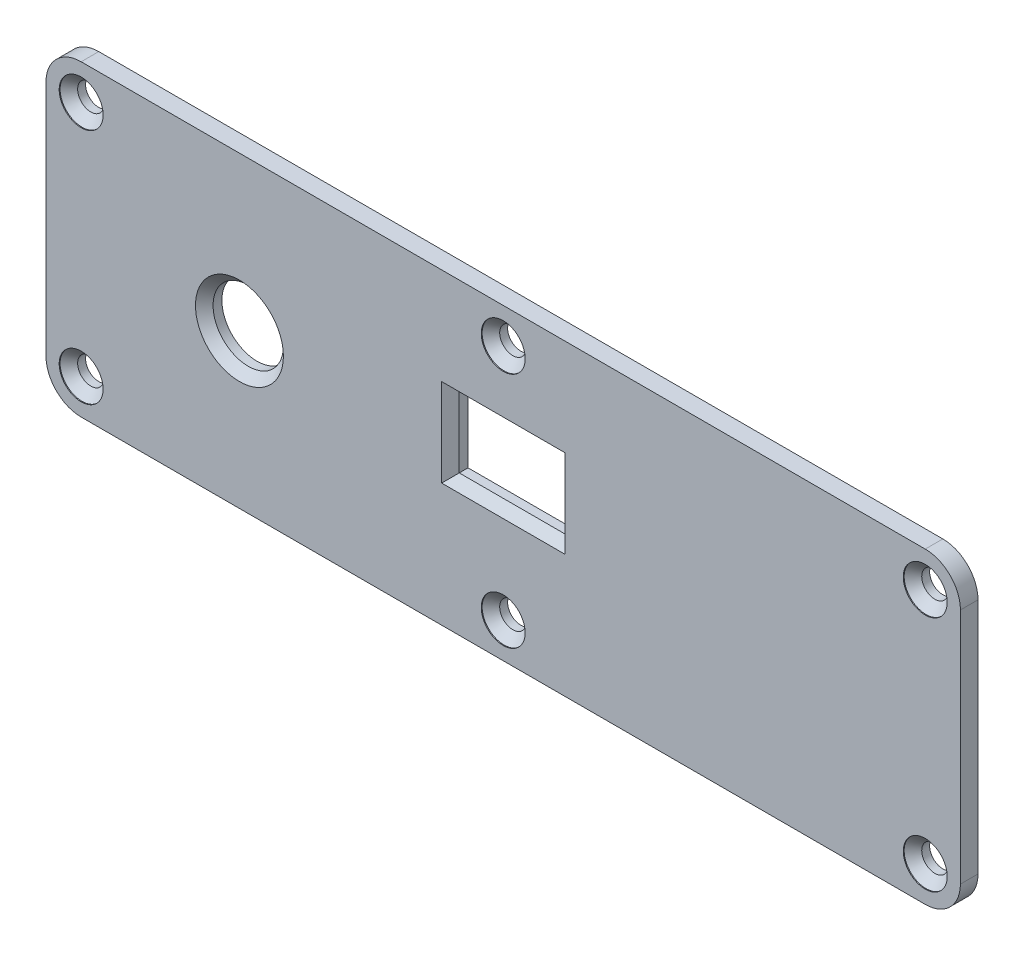
from build123d import *

# Parameters (mm, degrees)
IZIM1_W                     = 104
IZIM1_H                     = 35
Y_KSEKLIK_EKSTR_ZYON1_DEPTH = 2
IZIM2_R                     = 1.5
KES_EKSTR_ZYON1_DEPTH       = 2
IZIM3_R                     = 2.5
KES_EKSTR_ZYON2_DEPTH       = 0.1
PAH2_SIZE                   = 1
IZIM4_R                     = 1.5
KES_EKSTR_ZYON3_DEPTH       = 2
IZIM5_R                     = 2.5
KES_EKSTR_ZYON4_DEPTH       = 0.1
PAH3_SIZE                   = 1
RADYUS1_R                   = 4
IZIM6_R                     = 4
IZIM6_W                     = 12
IZIM6_H                     = 8
KES_EKSTR_ZYON5_DEPTH       = 2
PAH4_SIZE                   = 1
PAH5_SIZE                   = 1


with BuildPart() as part:
    # Çizim1 → Yükseklik-Ekstrüzyon1 (new body)
    with BuildSketch(Plane.XY):
        with Locations((-52, 17.5)):
            Rectangle(IZIM1_W, IZIM1_H)
    extrude(amount=Y_KSEKLIK_EKSTR_ZYON1_DEPTH)

    # Çizim2 → Kes-Ekstrüzyon1 (cut)
    with BuildSketch(Plane.XY.offset(2)):
        with Locations((-100, 31)):
            Circle(IZIM2_R)
        with Locations((-100, 4)):
            Circle(IZIM2_R)
        with Locations(Location((-4, 4, 0), (0, 0, 180))):
            Circle(IZIM2_R)
        with Locations(Location((-4, 31, 0), (0, 0, 180))):
            Circle(IZIM2_R)
    extrude(amount=-KES_EKSTR_ZYON1_DEPTH, mode=Mode.SUBTRACT)

    # Çizim3 → Kes-Ekstrüzyon2 (cut)
    with BuildSketch(Plane.XY.offset(2)):
        with Locations((-100, 31)):
            Circle(IZIM3_R)
        with Locations((-100, 4)):
            Circle(IZIM3_R)
        with Locations(Location((-4, 4, 0), (0, 0, 180))):
            Circle(IZIM3_R)
        with Locations(Location((-4, 31, 0), (0, 0, 180))):
            Circle(IZIM3_R)
    extrude(amount=-KES_EKSTR_ZYON2_DEPTH, mode=Mode.SUBTRACT)

    # Pah2
    pah2_edges = [part.edges().sort_by_distance(p)[0] for p in [
        (-2.5, 31, 1.9),
        (-2.5, 4, 1.9),
        (-101.5, 4, 1.9),
        (-101.5, 31, 1.9),
    ]]
    chamfer(pah2_edges, length=PAH2_SIZE - 0.0001)  # a hair under: the kernel refuses the full size

    # Çizim4 → Kes-Ekstrüzyon3 (cut)
    with BuildSketch(Plane.XY.offset(2)):
        with Locations((-52, 31)):
            Circle(IZIM4_R)
        with Locations((-52, 4)):
            Circle(IZIM4_R)
    extrude(amount=-KES_EKSTR_ZYON3_DEPTH, mode=Mode.SUBTRACT)

    # Çizim5 → Kes-Ekstrüzyon4 (cut)
    with BuildSketch(Plane.XY.offset(2)):
        with Locations((-52, 31)):
            Circle(IZIM5_R)
        with Locations((-52, 4)):
            Circle(IZIM5_R)
    extrude(amount=-KES_EKSTR_ZYON4_DEPTH, mode=Mode.SUBTRACT)

    # Pah3
    pah3_edges = [part.edges().sort_by_distance(p)[0] for p in [
        (-53.5, 31, 1.9),
        (-53.5, 4, 1.9),
    ]]
    chamfer(pah3_edges, length=PAH3_SIZE - 0.0001)  # a hair under: the kernel refuses the full size

    # Radyus1
    radyus1_edges = [part.edges().sort_by_distance(p)[0] for p in [
        (0, 0, 1),
        (-104, 0, 1),
        (-104, 35, 1),
        (0, 35, 1),
    ]]
    fillet(radyus1_edges, radius=RADYUS1_R)

    # Çizim6 → Kes-Ekstrüzyon5 (cut)
    with BuildSketch(Plane.XY.offset(2)):
        with Locations((-82, 17.5)):
            Circle(IZIM6_R)
        with Locations((-52, 19)):
            Rectangle(IZIM6_W, IZIM6_H)
    extrude(amount=-KES_EKSTR_ZYON5_DEPTH, mode=Mode.SUBTRACT)

    # Pah4
    pah4_edges = [part.edges().sort_by_distance(p)[0] for p in [
        (-58, 19, 2),
        (-52, 15, 2),
        (-46, 19, 2),
        (-52, 23, 2),
    ]]
    chamfer(pah4_edges, length=PAH4_SIZE)

    # Pah5
    pah5_edges = [part.edges().sort_by_distance(p)[0] for p in [
        (-86, 17.5, 2),
    ]]
    chamfer(pah5_edges, length=PAH5_SIZE)


solid = part.part
